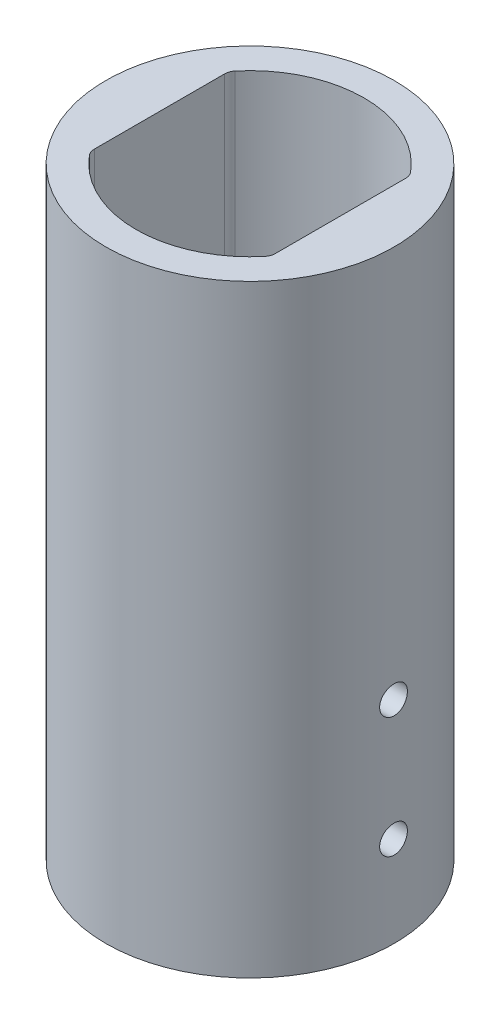
from build123d import *

# Parameters (mm, degrees)
SKETCH1_R               = 23.9
BOSS_EXTRUDE1_DEPTH     = 100
CUT_EXTRUDE1_DEPTH      = 106.557661967
CUT_EXTRUDE1_DEPTH_BACK = 106.557661967
SKETCH2_R               = 2.3
FILLET1_R               = 2


with BuildPart() as part:
    # Sketch1 → Boss-Extrude1 (new body)
    with BuildSketch(Plane(origin=(0, 0, 0), x_dir=(1, 0, 0), z_dir=(0, 1, 0))):
        Circle(SKETCH1_R)
        with BuildLine():
            Line((-15, -11.498260738), (-15, 11.498260738))
            ThreePointArc((-15, 11.498260738), (0, 18.9), (15, 11.498260738))
            Line((15, 11.498260738), (15, -11.498260738))
            ThreePointArc((15, -11.498260738), (0, -18.9), (-15, -11.498260738))
        make_face(mode=Mode.SUBTRACT)
    extrude(amount=BOSS_EXTRUDE1_DEPTH)

    # Sketch2 → Cut-Extrude1 (cut, two sides: drawn at the far end of the back side and taken through both)
    with BuildSketch(Plane(origin=(0, 0, 0), x_dir=(0, 0, -1), z_dir=(1, 0, 0)).offset(-CUT_EXTRUDE1_DEPTH_BACK)):
        with Locations((0, 15)):
            Circle(SKETCH2_R)
        with Locations((0, 35)):
            Circle(SKETCH2_R)
    extrude(amount=CUT_EXTRUDE1_DEPTH + CUT_EXTRUDE1_DEPTH_BACK, mode=Mode.SUBTRACT)

    # Fillet1
    fillet1_edges = [part.edges().sort_by_distance(p)[0] for p in [
        (-15, 50, 11.498260738),
        (-15, 50, -11.498260738),
        (15, 50, 11.498260738),
        (15, 50, -11.498260738),
    ]]
    fillet(fillet1_edges, radius=FILLET1_R)


solid = part.part
